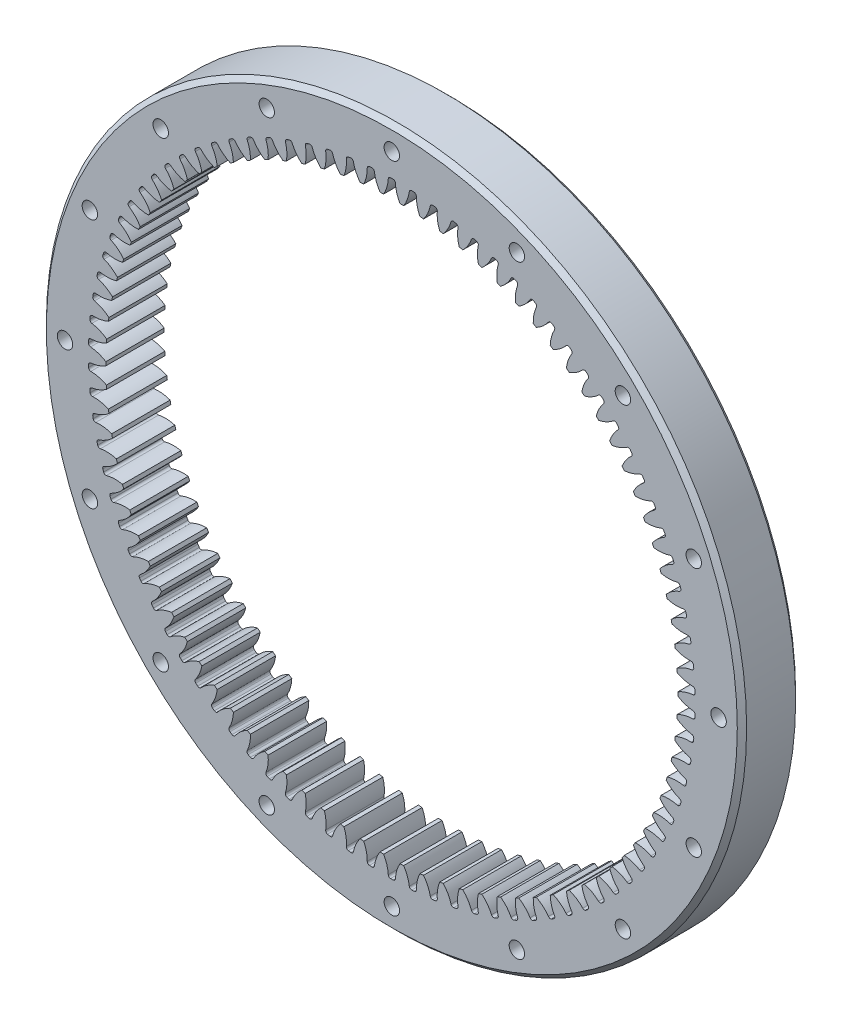
from build123d import *

# Parameters (mm, degrees)
SKETCH1_R                = 150
SKETCH1_R_2              = 122.5
BOSS_EXTRUDE1_DEPTH      = 12.5
CUT_EXTRUDE1_DEPTH       = 214.600093633
FILLET1_R                = 1
CIRPATTERN1_COUNT        = 90
FILLET1_OF_CIRPATTERN1_R = 1
CHAMFER1_SIZE            = 2
SKETCH5_R                = 3.3
CUT_EXTRUDE2_DEPTH       = 214.600093645
CIRPATTERN2_COUNT        = 16


with BuildPart() as part:
    # Sketch1 → Boss-Extrude1 (new, symmetric)
    with BuildSketch(Plane.XY):
        Circle(SKETCH1_R)
        Circle(SKETCH1_R_2, mode=Mode.SUBTRACT)
    extrude(amount=BOSS_EXTRUDE1_DEPTH, both=True)

    # Sketch2 → Cut-Extrude1 (cut, through all)
    with BuildSketch(Plane.XY.offset(12.5)):
        with BuildLine():
            ThreePointArc((1.5, 129.991345866), (0, 130), (-1.5, 129.991345866))
            ThreePointArc((-1.5, 129.991345866), (-2.001099209, 126.088357198), (-3.5, 122.449989792))
            ThreePointArc((-3.5, 122.449989792), (0, 122.5), (3.5, 122.449989792))
            ThreePointArc((3.5, 122.449989792), (2.001099209, 126.088357198), (1.5, 129.991345866))
        make_face()
    cut_extrude1 = extrude(amount=-CUT_EXTRUDE1_DEPTH, mode=Mode.SUBTRACT)

    # Fillet1
    fillet1_edges = [part.edges().sort_by_distance(p)[0] for p in [
        (1.5, 129.991345866, 0),
        (-1.5, 129.991345866, 0),
    ]]
    fillet(fillet1_edges, radius=FILLET1_R)

    # CirPattern1: Cut-Extrude1 ×90 about axis
    cirpattern1_axis = Axis((0, 0, 12.5), (0, 0, -1))
    for i in range(1, CIRPATTERN1_COUNT):
        add(cut_extrude1.rotate(cirpattern1_axis, i * 360 / CIRPATTERN1_COUNT), mode=Mode.SUBTRACT)

    # Fillet1 of CirPattern1
    fillet1_of_cirpattern1_edges = [part.edges().sort_by_distance(p)[0] for p in [
        (10.56408398, 129.57005877, 0),
        (7.571391829, 129.779328191, 0),
        (19.576700805, 128.517519372, 0),
        (16.605896599, 128.935038675, 0),
        (28.493941912, 126.838855539, 0),
        (25.55949911, 127.462590611, 0),
        (37.272363397, 124.542245551, 0),
        (34.38857831, 125.369157618, 0),
        (45.869197675, 121.638878261, 0),
        (43.050119813, 122.664938691, 0),
        (54.242561833, 118.142898584, 0),
        (51.50192546, 119.363108513, 0),
        (62.351661682, 114.071338581, 0),
        (59.702818903, 115.479753269, 0),
        (70.156990502, 109.444034482, 0),
        (67.612846214, 111.033792275, 0),
        (77.620521517, 104.283530049, 0),
        (75.193470534, 106.046885806, 0),
        (84.705893154, 98.61496674, 0),
        (82.407759824, 100.543329569, 0),
        (91.378586193, 92.465961225, 0),
        (89.220566792, 94.549936337, 0),
        (97.606091947, 85.866470842, 0),
        (95.598700127, 88.095905319, 0),
        (103.358070631, 78.848647645, 0),
        (101.511086205, 81.212679906, 0),
        (108.606499185, 71.446681762, 0),
        (106.928920475, 73.93379448, 0),
        (113.325807792, 63.696634827, 0),
        (111.825807792, 66.294711039, 0),
        (117.493004455, 55.63626429, 0),
        (116.177891014, 58.332646429, 0),
        (121.08778701, 47.304839466, 0),
        (119.96396723, 50.08639103, 0),
        (124.092642039, 38.74295022, 0),
        (123.165591056, 41.596119769, 0),
        (126.49293019, 29.992309214, 0),
        (125.767164503, 32.903196393, 0),
        (128.2769575, 21.095548693, 0),
        (127.756012967, 24.049971952, 0),
        (129.436032367, 12.096012778, 0),
        (129.122446977, 15.079578464, 0),
        (129.964507895, 3.037546306, 0),
        (129.859809405, 6.035718787, 0),
        (129.859809405, -6.035718787, 0),
        (129.964507895, -3.037546306, 0),
        (129.122446977, -15.079578464, 0),
        (129.436032367, -12.096012778, 0),
        (127.756012967, -24.049971952, 0),
        (128.2769575, -21.095548693, 0),
        (125.767164503, -32.903196393, 0),
        (126.49293019, -29.992309214, 0),
        (123.165591056, -41.596119769, 0),
        (124.092642039, -38.74295022, 0),
        (119.96396723, -50.08639103, 0),
        (121.08778701, -47.304839466, 0),
        (116.177891014, -58.332646429, 0),
        (117.493004455, -55.63626429, 0),
        (111.825807792, -66.294711039, 0),
        (113.325807792, -63.696634827, 0),
        (106.928920475, -73.93379448, 0),
        (108.606499185, -71.446681762, 0),
        (101.511086205, -81.212679906, 0),
        (103.358070631, -78.848647645, 0),
        (95.598700127, -88.095905319, 0),
        (97.606091947, -85.866470842, 0),
        (89.220566792, -94.549936337, 0),
        (91.378586193, -92.465961225, 0),
        (82.407759824, -100.543329569, 0),
        (84.705893154, -98.61496674, 0),
        (75.193470534, -106.046885806, 0),
        (77.620521517, -104.283530049, 0),
        (67.612846214, -111.033792275, 0),
        (70.156990502, -109.444034482, 0),
        (59.702818903, -115.479753269, 0),
        (62.351661682, -114.071338581, 0),
        (51.50192546, -119.363108513, 0),
        (54.242561833, -118.142898584, 0),
        (43.050119813, -122.664938691, 0),
        (45.869197675, -121.638878261, 0),
        (34.38857831, -125.369157618, 0),
        (37.272363397, -124.542245551, 0),
        (25.55949911, -127.462590611, 0),
        (28.493941912, -126.838855539, 0),
        (16.605896599, -128.935038675, 0),
        (19.576700805, -128.517519372, 0),
        (7.571391829, -129.779328191, 0),
        (10.56408398, -129.57005877, 0),
        (-1.5, -129.991345866, 0),
        (1.5, -129.991345866, 0),
        (-10.56408398, -129.57005877, 0),
        (-7.571391829, -129.779328191, 0),
        (-19.576700805, -128.517519372, 0),
        (-16.605896599, -128.935038675, 0),
        (-28.493941912, -126.838855539, 0),
        (-25.55949911, -127.462590611, 0),
        (-37.272363397, -124.542245551, 0),
        (-34.38857831, -125.369157618, 0),
        (-45.869197675, -121.638878261, 0),
        (-43.050119813, -122.664938691, 0),
        (-54.242561833, -118.142898584, 0),
        (-51.50192546, -119.363108513, 0),
        (-62.351661682, -114.071338581, 0),
        (-59.702818903, -115.479753269, 0),
        (-70.156990502, -109.444034482, 0),
        (-67.612846214, -111.033792275, 0),
        (-77.620521517, -104.283530049, 0),
        (-75.193470534, -106.046885806, 0),
        (-84.705893154, -98.61496674, 0),
        (-82.407759824, -100.543329569, 0),
        (-91.378586193, -92.465961225, 0),
        (-89.220566792, -94.549936337, 0),
        (-97.606091947, -85.866470842, 0),
        (-95.598700127, -88.095905319, 0),
        (-103.358070631, -78.848647645, 0),
        (-101.511086205, -81.212679906, 0),
        (-108.606499185, -71.446681762, 0),
        (-106.928920475, -73.93379448, 0),
        (-113.325807792, -63.696634827, 0),
        (-111.825807792, -66.294711039, 0),
        (-117.493004455, -55.63626429, 0),
        (-116.177891014, -58.332646429, 0),
        (-121.08778701, -47.304839466, 0),
        (-119.96396723, -50.08639103, 0),
        (-124.092642039, -38.74295022, 0),
        (-123.165591056, -41.596119769, 0),
        (-126.49293019, -29.992309214, 0),
        (-125.767164503, -32.903196393, 0),
        (-128.2769575, -21.095548693, 0),
        (-127.756012967, -24.049971952, 0),
        (-129.436032367, -12.096012778, 0),
        (-129.122446977, -15.079578464, 0),
        (-129.964507895, -3.037546306, 0),
        (-129.859809405, -6.035718787, 0),
        (-129.859809405, 6.035718787, 0),
        (-129.964507895, 3.037546306, 0),
        (-129.122446977, 15.079578464, 0),
        (-129.436032367, 12.096012778, 0),
        (-127.756012967, 24.049971952, 0),
        (-128.2769575, 21.095548693, 0),
        (-125.767164503, 32.903196393, 0),
        (-126.49293019, 29.992309214, 0),
        (-123.165591056, 41.596119769, 0),
        (-124.092642039, 38.74295022, 0),
        (-119.96396723, 50.08639103, 0),
        (-121.08778701, 47.304839466, 0),
        (-116.177891014, 58.332646429, 0),
        (-117.493004455, 55.63626429, 0),
        (-111.825807792, 66.294711039, 0),
        (-113.325807792, 63.696634827, 0),
        (-106.928920475, 73.93379448, 0),
        (-108.606499185, 71.446681762, 0),
        (-101.511086205, 81.212679906, 0),
        (-103.358070631, 78.848647645, 0),
        (-95.598700127, 88.095905319, 0),
        (-97.606091947, 85.866470842, 0),
        (-89.220566792, 94.549936337, 0),
        (-91.378586193, 92.465961225, 0),
        (-82.407759824, 100.543329569, 0),
        (-84.705893154, 98.61496674, 0),
        (-75.193470534, 106.046885806, 0),
        (-77.620521517, 104.283530049, 0),
        (-67.612846214, 111.033792275, 0),
        (-70.156990502, 109.444034482, 0),
        (-59.702818903, 115.479753269, 0),
        (-62.351661682, 114.071338581, 0),
        (-51.50192546, 119.363108513, 0),
        (-54.242561833, 118.142898584, 0),
        (-43.050119813, 122.664938691, 0),
        (-45.869197675, 121.638878261, 0),
        (-34.38857831, 125.369157618, 0),
        (-37.272363397, 124.542245551, 0),
        (-25.55949911, 127.462590611, 0),
        (-28.493941912, 126.838855539, 0),
        (-16.605896599, 128.935038675, 0),
        (-19.576700805, 128.517519372, 0),
        (-7.571391829, 129.779328191, 0),
        (-10.56408398, 129.57005877, 0),
    ]]
    fillet(fillet1_of_cirpattern1_edges, radius=FILLET1_OF_CIRPATTERN1_R)

    # Chamfer1
    chamfer1_edges = [part.edges().sort_by_distance(p)[0] for p in [
        (-150, 0, -12.5),
        (-150, 0, 12.5),
    ]]
    chamfer(chamfer1_edges, length=CHAMFER1_SIZE)

    # Sketch5 → Cut-Extrude2 (cut, through all)
    with BuildSketch(Plane.XY.offset(12.5)):
        with Locations((0, 140)):
            Circle(SKETCH5_R)
    cut_extrude2 = extrude(amount=-CUT_EXTRUDE2_DEPTH, mode=Mode.SUBTRACT)

    # CirPattern2: Cut-Extrude2 ×16 about axis
    cirpattern2_axis = Axis((0, 0, 12.5), (0, 0, -1))
    for i in range(1, CIRPATTERN2_COUNT):
        add(cut_extrude2.rotate(cirpattern2_axis, i * 360 / CIRPATTERN2_COUNT), mode=Mode.SUBTRACT)


solid = part.part
